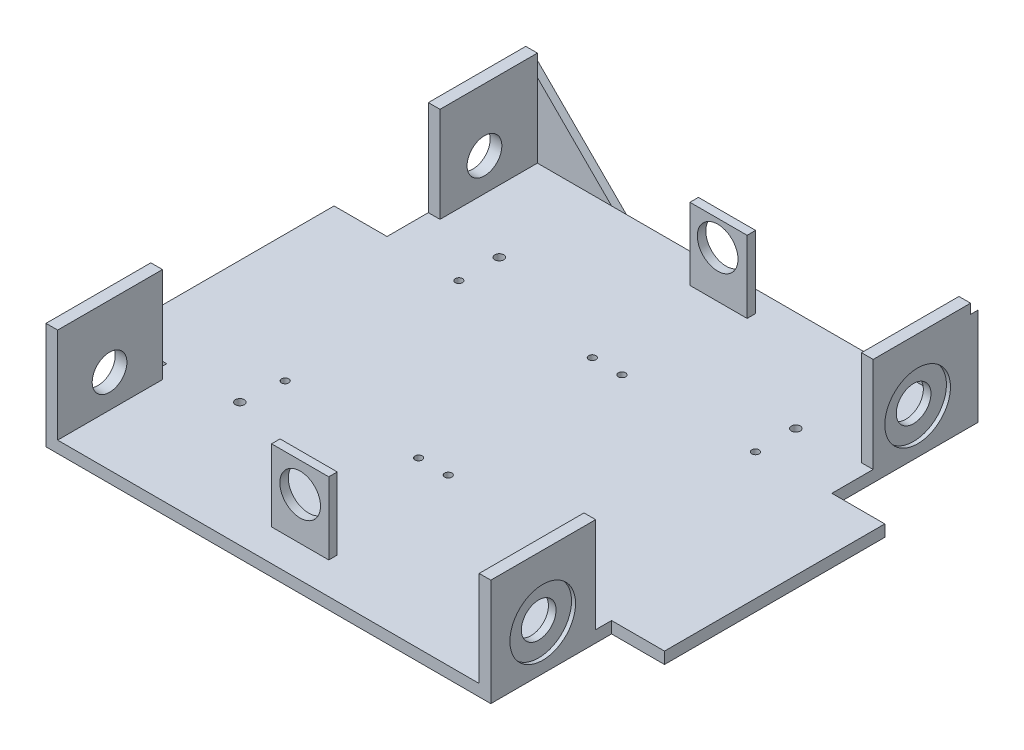
from build123d import *

# Parameters (mm, degrees)
EXTRUDE_1_DEPTH      = 5.5
SKETCH_5_W           = 5.5
SKETCH_5_H           = 49.5
SKETCH_5_H_2         = 46
EXTRUDE_2_DEPTH      = 45
EXTRUDE_4_DEPTH      = 3.5
SKETCH_10_W          = 5.5
SKETCH_10_H          = 46
SKETCH_10_H_2        = 49.5
EXTRUDE_5_DEPTH      = 45
EXTRUDE_6_DEPTH      = 3.5
SKETCH_18_R          = 8.2
CUT_EXTRUDE_2_DEPTH  = 270.102675572
SKETCH_9_R           = 1.7
CUT_EXTRUDE_20_DEPTH = 10
CHAMFER_1_SIZE       = 1.5
SKETCH_24_R          = 2.1
CUT_EXTRUDE_6_DEPTH  = 10
SKETCH_25_W          = 27
SKETCH_25_H          = 4
EXTRUDE_7_DEPTH      = 34
SKETCH_27_R          = 9.6
CUT_EXTRUDE_11_DEPTH = 34
SKETCH_35_R          = 9.6
CUT_EXTRUDE_12_DEPTH = 34
SKETCH_53_R          = 15.5
CUT_EXTRUDE_16_DEPTH = 1.9


with BuildPart() as part:
    # 草图2 → 凸台-拉伸1 (new body)
    with BuildSketch(Plane(origin=(0, 0, 0), x_dir=(1, 0, 0), z_dir=(0, 1, 0))):
        Polygon((105, -109), (-105, -109), (-105, -52), (-130, -52), (-130, 52), (-105, 52), (-105, 117.5), (105, 117.5), (105, 52), (130, 52), (130, -52), (105, -52), align=None)
    extrude(amount=EXTRUDE_1_DEPTH)

    # 草图5 → 凸台-拉伸2 (add)
    with BuildSketch(Plane(origin=(0, 5.5, 0), x_dir=(1, 0, 0), z_dir=(0, 1, 0))):
        with Locations((102.25, -84.25)):
            Rectangle(SKETCH_5_W, SKETCH_5_H)
        with Locations((102.25, 94.5)):
            Rectangle(SKETCH_5_W, SKETCH_5_H_2)
    extrude(amount=EXTRUDE_2_DEPTH)

    # 草图8 → 凸台-拉伸4 (add)
    with BuildSketch(Plane(origin=(0, 0, -117.5), x_dir=(-1, 0, 0), z_dir=(0, 0, -1))):
        Polygon((-105, 45.921035741), (-59.078964259, 0), (-105, 0), align=None)
    extrude(amount=EXTRUDE_4_DEPTH)

    # 草图10 → 凸台-拉伸5 (add)
    with BuildSketch(Plane(origin=(0, 5.5, 0), x_dir=(1, 0, 0), z_dir=(0, 1, 0))):
        with Locations((-102.25, 94.5)):
            Rectangle(SKETCH_10_W, SKETCH_10_H)
        with Locations((-102.25, -84.25)):
            Rectangle(SKETCH_10_W, SKETCH_10_H_2)
    extrude(amount=EXTRUDE_5_DEPTH)

    # 草图11 → 凸台-拉伸6 (add)
    with BuildSketch(Plane(origin=(0, 0, -117.5), x_dir=(-1, 0, 0), z_dir=(0, 0, -1))):
        Polygon((59, 0), (105, 46), (105, 0), align=None)
    extrude(amount=EXTRUDE_6_DEPTH)

    # 草图18 → 切除-拉伸2 (cut, through all)
    with BuildSketch(Plane.ZY.offset(105)):
        with Locations((-92.5, 21)):
            Circle(SKETCH_18_R)
        with Locations((84.5, 21)):
            Circle(SKETCH_18_R)
    extrude(amount=-CUT_EXTRUDE_2_DEPTH, mode=Mode.SUBTRACT)

    # 草图9 → 切除-拉伸20 (cut)
    with BuildSketch(Plane(origin=(0, 5.5, 0), x_dir=(1, 0, 0), z_dir=(0, 1, 0))):
        with Locations((-7, 50.922906318)):
            Circle(SKETCH_9_R)
        with Locations((-70, 50.922906318)):
            Circle(SKETCH_9_R)
        with Locations((-70, -31.077093682)):
            Circle(SKETCH_9_R)
        with Locations((-7, -31.077093682)):
            Circle(SKETCH_9_R)
        with Locations((7, -31.077093682)):
            Circle(SKETCH_9_R)
        with Locations((70, -31.077093682)):
            Circle(SKETCH_9_R)
        with Locations((70, 50.922906318)):
            Circle(SKETCH_9_R)
        with Locations((7, 50.922906318)):
            Circle(SKETCH_9_R)
    extrude(amount=-CUT_EXTRUDE_20_DEPTH, mode=Mode.SUBTRACT)

    # Chamfer 1
    chamfer_1_edges = [part.edges().sort_by_distance(p)[0] for p in [
        (-71.7, 0, -50.922906318),
        (-71.7, 0, 31.077093682),
        (-8.7, 0, 31.077093682),
        (5.3, 0, 31.077093682),
        (68.3, 0, 31.077093682),
        (68.3, 0, -50.922906318),
        (-8.7, 0, -50.922906318),
        (5.3, 0, -50.922906318),
    ]]
    chamfer(chamfer_1_edges, length=CHAMFER_1_SIZE)

    # 草图24 → 切除-拉伸6 (cut)
    with BuildSketch(Plane(origin=(0, 5.5, 0), x_dir=(1, 0, 0), z_dir=(0, 1, 0))):
        with Locations((-72, -50.483401346)):
            Circle(SKETCH_24_R)
        with Locations((-70, 70)):
            Circle(SKETCH_24_R)
        with Locations((72, -50.483401346)):
            Circle(SKETCH_24_R)
        with Locations((70, 70)):
            Circle(SKETCH_24_R)
    extrude(amount=-CUT_EXTRUDE_6_DEPTH, mode=Mode.SUBTRACT)

    # 草图25 → 凸台-拉伸7 (add)
    with BuildSketch(Plane(origin=(0, 5.5, 0), x_dir=(1, 0, 0), z_dir=(0, 1, 0))):
        with Locations((0, -92)):
            Rectangle(SKETCH_25_W, SKETCH_25_H)
        with Locations((0, 105.5)):
            Rectangle(SKETCH_25_W, SKETCH_25_H)
    extrude(amount=EXTRUDE_7_DEPTH)

    # 草图27 → 切除-拉伸11 (cut)
    with BuildSketch(Plane.XY.offset(94)):
        with Locations((0, 25.5)):
            Circle(SKETCH_27_R)
    extrude(amount=-CUT_EXTRUDE_11_DEPTH, mode=Mode.SUBTRACT)

    # 草图35 → 切除-拉伸12 (cut)
    with BuildSketch(Plane(origin=(0, 0, -107.5), x_dir=(-1, 0, 0), z_dir=(0, 0, -1))):
        with Locations((0.400813947, 27.5)):
            Circle(SKETCH_35_R)
    extrude(amount=-CUT_EXTRUDE_12_DEPTH, mode=Mode.SUBTRACT)

    # 草图53 → 切除-拉伸16 (cut)
    with BuildSketch(Plane(origin=(105, 0, 0), x_dir=(0, 0, -1), z_dir=(1, 0, 0))):
        with Locations((-84.5, 21)):
            Circle(SKETCH_53_R)
        with Locations((92.5, 21)):
            Circle(SKETCH_53_R)
    extrude(amount=-CUT_EXTRUDE_16_DEPTH, mode=Mode.SUBTRACT)


solid = part.part
